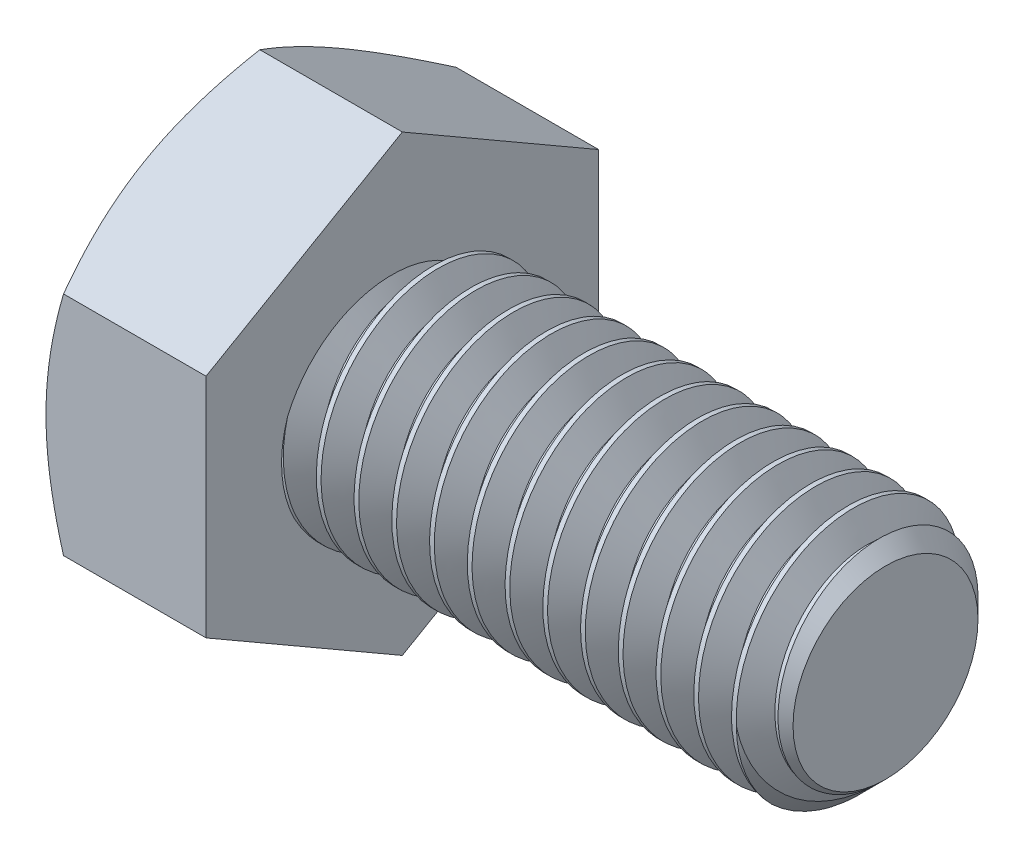
from build123d import *

# Parameters (mm, degrees)
SKETCH2_R           = 4
BOSS_EXTRUDE1_DEPTH = 16
CHAMFER1_SIZE       = 0.9375
CUT_SWEEP1_PITCH    = 1.25
BOSS_EXTRUDE2_DEPTH = 5.3
SKETCH6_OUTSIDE_W   = 105.696
SKETCH6_OUTSIDE_H   = 107.708
SKETCH6_OUTSIDE_R   = 6.5
CUT_EXTRUDE1_DEPTH  = 24.500496599
CUT_EXTRUDE1_DRAFT  = -60
SKETCH7_W           = 0.197562976
SKETCH7_H           = 0.197562976
CUT_EXTRUDE2_DEPTH  = 0.25


with BuildPart() as part:
    # Sketch2 → Boss-Extrude1 (new body)
    with BuildSketch(Plane(origin=(10.65, 0, 0), x_dir=(0, 0, -1), z_dir=(1, 0, 0))):
        Circle(SKETCH2_R)
    extrude(amount=-BOSS_EXTRUDE1_DEPTH)

    # Chamfer1
    chamfer1_edges = [part.edges().sort_by_distance(p)[0] for p in [
        (10.65, 0, 4),
    ]]
    chamfer(chamfer1_edges, length=CHAMFER1_SIZE)

    # Cut-Sweep1: the profile of Sketch5 profile screwed along a right-hand helix of 13.8 turns, 8 arcs to a turn; built about Z, then put on its axis
    cut_sweep1_z = Axis((0, 0, 0), (0, 0, 1))
    cut_sweep1_corners = [(4.0003, 0, 0.000173205), (3.188101184, 0, -0.46875), (3.188101184, 0, -0.625), (4.0003, 0, -1.093923205)]
    with BuildLine(mode=Mode.PRIVATE) as cut_sweep1_profile:
        Line(cut_sweep1_corners[0], cut_sweep1_corners[1])
        Line(cut_sweep1_corners[1], cut_sweep1_corners[2])
        Line(cut_sweep1_corners[2], cut_sweep1_corners[3])
        Line(cut_sweep1_corners[3], cut_sweep1_corners[0])
    cut_sweep1_cap = Face(cut_sweep1_profile.wire())
    cut_sweep1_turn_angles = [0, 22.5, 45, 67.5, 90, 112.5, 135, 157.5, 180, 202.5, 225, 247.5, 270, 292.5, 315, 337.5, 360]
    cut_sweep1_turn_weights = [1, 0.9238795325112867, 1, 0.9238795325112867, 1, 0.9238795325112867, 1, 0.9238795325112867, 1, 0.9238795325112867, 1, 0.9238795325112867, 1, 0.9238795325112867, 1, 0.9238795325112867, 1]
    cut_sweep1_turn_rails = [Edge.make_bspline([Vector(p[0], p[1], 0).rotate(cut_sweep1_z, cut_sweep1_turn_angles[k]) / cut_sweep1_turn_weights[k] + Vector(0, 0, p[2] + CUT_SWEEP1_PITCH * cut_sweep1_turn_angles[k] / 360) for k in range(17)], [0, 0, 0, 1, 1, 2, 2, 3, 3, 4, 4, 5, 5, 6, 6, 7, 7, 8, 8, 8], 2, cut_sweep1_turn_weights) for p in cut_sweep1_corners]
    cut_sweep1_turn_sides = [Face.make_surface_from_curves(cut_sweep1_turn_rails[p[0]], cut_sweep1_turn_rails[p[1]]) for p in [(0, 1), (1, 2), (2, 3), (3, 0)]]
    cut_sweep1_last_angles = [4680, 4702.5, 4725, 4747.5, 4770, 4792.5, 4815, 4837.5, 4860, 4882.5, 4905, 4927.5, 4950, 4959, 4968]
    cut_sweep1_last_weights = [1, 0.9238795325112867, 1, 0.9238795325112867, 1, 0.9238795325112867, 1, 0.9238795325112867, 1, 0.9238795325112867, 1, 0.9238795325112867, 1, 0.9876883405951452, 1]
    cut_sweep1_last_rails = [Edge.make_bspline([Vector(p[0], p[1], 0).rotate(cut_sweep1_z, cut_sweep1_last_angles[k]) / cut_sweep1_last_weights[k] + Vector(0, 0, p[2] + CUT_SWEEP1_PITCH * cut_sweep1_last_angles[k] / 360) for k in range(15)], [0, 0, 0, 1, 1, 2, 2, 3, 3, 4, 4, 5, 5, 6, 6, 7, 7, 7], 2, cut_sweep1_last_weights) for p in cut_sweep1_corners]
    cut_sweep1_last_sides = [Face.make_surface_from_curves(cut_sweep1_last_rails[p[0]], cut_sweep1_last_rails[p[1]]) for p in [(0, 1), (1, 2), (2, 3), (3, 0)]]
    cut_sweep1 = Plane(origin=(10.65, 0, 0), x_dir=(0, 1, 0), z_dir=(-1, 0, 0)) * Solid(Shell([*[p.moved(Location((0, 0, CUT_SWEEP1_PITCH * i))) for i in range(13) for p in cut_sweep1_turn_sides], *cut_sweep1_last_sides, cut_sweep1_cap, cut_sweep1_cap.rotate(cut_sweep1_z, 4968).moved(Location((0, 0, CUT_SWEEP1_PITCH * 4968 / 360)))]))
    add(cut_sweep1, mode=Mode.SUBTRACT)

    # Sketch3 → Boss-Extrude2 (add)
    with BuildSketch(Plane.ZY.offset(5.35)):
        Polygon((-6.5, -3.75277675), (0, -7.505553499), (6.5, -3.75277675), (6.5, 3.75277675), (0, 7.505553499), (-6.5, 3.75277675), align=None)
    extrude(amount=BOSS_EXTRUDE2_DEPTH)


with BuildPart() as cut_extrude1_tool:
    # Sketch6 outside → Cut-Extrude1 (with draft: the straight prism first)
    with BuildSketch(Plane.ZY.offset(10.65)):
        Rectangle(SKETCH6_OUTSIDE_W, SKETCH6_OUTSIDE_H)
        Circle(SKETCH6_OUTSIDE_R, mode=Mode.SUBTRACT)
    extrude(amount=-CUT_EXTRUDE1_DEPTH)
    # Cut-Extrude1: the draft: its side faces are tilted about the plane it starts from
    cut_extrude1_sides = [cut_extrude1_tool.faces().sort_by_distance(p)[0] for p in [
        (1.600248299, -53.854, 0),
        (1.600248299, 0, 52.848),
        (1.600248299, 53.854, 0),
        (1.600248299, 0, -52.848),
        (1.600248299, 0, -6.5),
    ]]
    draft(cut_extrude1_sides, Plane.ZY.offset(10.65), CUT_EXTRUDE1_DRAFT)


with BuildPart() as part_1:
    add(part.part)

    # Cut-Extrude1: cut by cut_extrude1_tool
    add(cut_extrude1_tool.part, mode=Mode.SUBTRACT)

    # Sketch7 → Cut-Extrude2 (cut)
    # profile 1 of 3: a face of its own
    with BuildSketch(Plane.ZY.offset(10.65)):
        with BuildLine():
            add(Edge.make_bspline(
                [(-1.090300672, 4.095199106), (-1.10904591, 4.102532349), (-1.144986747, 4.116592608), (-1.19346167, 4.144731144), (-1.234487944, 4.177100824), (-1.26756182, 4.214482221), (-1.292770127, 4.256102561), (-1.310921105, 4.301431184), (-1.321552451, 4.350720623), (-1.322951659, 4.384803), (-1.323671938, 4.402347795)],
                knots=[0, 0, 0, 0, 1.16287356, 2.229614231, 3.228817875, 4.173350329, 5.100165549, 6.029633206, 6.985702163, 8, 8, 8, 8], degree=3))
            add(Edge.make_bspline(
                [(-1.323671938, 4.402347795), (-1.323332936, 4.415847741), (-1.322667465, 4.442348557), (-1.316917644, 4.481234018), (-1.307708477, 4.518496018), (-1.294638515, 4.554029389), (-1.278263995, 4.588126603), (-1.257602111, 4.620162984), (-1.233852559, 4.651043945), (-1.206031088, 4.679521184), (-1.175372308, 4.705603578), (-1.142164064, 4.728814347), (-1.106152247, 4.747795114), (-1.067937276, 4.763664634), (-1.027330198, 4.776088791), (-0.984187971, 4.784550333), (-0.938662683, 4.789932502), (-0.907467674, 4.790632812), (-0.891502928, 4.790991211)],
                knots=[0, 0, 0, 0, 0.994101948, 1.951453197, 2.889123786, 3.817215529, 4.736003873, 5.669743943, 6.620499649, 7.601567446, 8.596478358, 9.582687259, 10.579761808, 11.589151689, 12.62747492, 13.702346593, 14.8241243, 16, 16, 16, 16], degree=3))
            add(Edge.make_bspline(
                [(-0.891502928, 4.790991211), (-0.875436453, 4.790629173), (-0.844140773, 4.789923964), (-0.798373618, 4.78461411), (-0.754959136, 4.775714465), (-0.713922888, 4.763088109), (-0.675200178, 4.746944553), (-0.639045453, 4.727102003), (-0.605086523, 4.703887727), (-0.574191365, 4.677024885), (-0.546080454, 4.647860574), (-0.521725005, 4.616615726), (-0.500836111, 4.584019418), (-0.483574579, 4.54987362), (-0.470804432, 4.513789502), (-0.461070714, 4.476446906), (-0.455424706, 4.43740213), (-0.454742415, 4.410906185), (-0.454394844, 4.39740872)],
                knots=[0, 0, 0, 0, 1.171211919, 2.281388661, 3.353996503, 4.398126828, 5.406889753, 6.407389155, 7.400009931, 8.40008733, 9.387021643, 10.349004252, 11.283445052, 12.206096336, 13.131640667, 14.068727932, 15.016178647, 16, 16, 16, 16], degree=3))
            add(Edge.make_bspline(
                [(-0.454394844, 4.39740872), (-0.454959462, 4.380468619), (-0.45606657, 4.347252266), (-0.467348502, 4.299370618), (-0.484932357, 4.254670699), (-0.510346333, 4.214004413), (-0.542532189, 4.176951768), (-0.58247227, 4.144741497), (-0.629560012, 4.116646938), (-0.6645934, 4.102540833), (-0.682827035, 4.095199106)],
                knots=[0, 0, 0, 0, 0.998680737, 1.958225066, 2.887911823, 3.823713378, 4.77537694, 5.772726054, 6.840782926, 8, 8, 8, 8], degree=3))
            add(Edge.make_bspline(
                [(-0.682827035, 4.095199106), (-0.671322795, 4.091293961), (-0.648779475, 4.083641573), (-0.616909948, 4.06876297), (-0.586905745, 4.052720306), (-0.558597671, 4.035354111), (-0.533030646, 4.015372905), (-0.509351678, 3.993958093), (-0.487660326, 3.970807897), (-0.468252869, 3.945725424), (-0.450925963, 3.919237111), (-0.436092756, 3.891278379), (-0.423495199, 3.862247184), (-0.412728892, 3.832008902), (-0.404864956, 3.800350539), (-0.399362666, 3.767417581), (-0.395871617, 3.733383598), (-0.395377091, 3.71026846), (-0.395125952, 3.698529693)],
                knots=[0, 0, 0, 0, 1.104208047, 2.163768705, 3.193778962, 4.198696312, 5.179575955, 6.14024585, 7.100368562, 8.060719304, 9.021161243, 9.975749006, 10.935506756, 11.897452199, 12.89163552, 13.897859372, 14.932451246, 16, 16, 16, 16], degree=3))
            add(Edge.make_bspline(
                [(-0.395125952, 3.698529693), (-0.395518566, 3.682350494), (-0.396292046, 3.650476238), (-0.403088084, 3.603688571), (-0.413370791, 3.558742632), (-0.428364165, 3.515828291), (-0.447514428, 3.474915209), (-0.471203535, 3.436062798), (-0.499198733, 3.399311024), (-0.530674211, 3.364545652), (-0.565863777, 3.33311926), (-0.603932369, 3.305425676), (-0.645022826, 3.282228768), (-0.688636579, 3.263021811), (-0.734982466, 3.248136491), (-0.784000913, 3.237713611), (-0.835675608, 3.231507244), (-0.871009164, 3.230670526), (-0.889033391, 3.230243702)],
                knots=[0, 0, 0, 0, 1.017598406, 2.004746413, 2.969099523, 3.915171376, 4.859468899, 5.806714415, 6.772805022, 7.762836953, 8.753334612, 9.736396794, 10.719437652, 11.716790048, 12.730404696, 13.776887535, 14.865953843, 16, 16, 16, 16], degree=3))
            add(Edge.make_bspline(
                [(-0.889033391, 3.230243702), (-0.907055815, 3.230679725), (-0.942385837, 3.231534475), (-0.994107744, 3.237613962), (-1.043056058, 3.248509339), (-1.089341685, 3.26340979), (-1.133215708, 3.282096716), (-1.174030202, 3.305816309), (-1.212347458, 3.333474808), (-1.247561492, 3.365095581), (-1.279298421, 3.399857245), (-1.306924581, 3.437151785), (-1.330473058, 3.476405251), (-1.349852944, 3.517838923), (-1.364624836, 3.561453179), (-1.374991925, 3.607084275), (-1.381800265, 3.654697342), (-1.382555285, 3.687186894), (-1.38294083, 3.70377746)],
                knots=[0, 0, 0, 0, 1.127066097, 2.209429196, 3.250843736, 4.258219581, 5.246860502, 6.227045772, 7.204057202, 8.19754525, 9.181483529, 10.142920909, 11.095356922, 12.039670968, 12.998174893, 13.969127444, 14.962948905, 16, 16, 16, 16], degree=3))
            add(Edge.make_bspline(
                [(-1.38294083, 3.70377746), (-1.382672847, 3.716130371), (-1.382147017, 3.74036892), (-1.378934902, 3.775920275), (-1.372533218, 3.809804454), (-1.364287442, 3.842221135), (-1.353817885, 3.873251416), (-1.340901695, 3.902651616), (-1.325231028, 3.930350678), (-1.307428123, 3.956528839), (-1.287268328, 3.981002318), (-1.265078386, 4.003556797), (-1.240777693, 4.023935731), (-1.214912328, 4.04273433), (-1.18639811, 4.058622835), (-1.156295471, 4.073203498), (-1.124086869, 4.0856381), (-1.101675528, 4.091980186), (-1.090300672, 4.095199106)],
                knots=[0, 0, 0, 0, 1.117345089, 2.192424383, 3.22371675, 4.232639188, 5.215561493, 6.182180952, 7.132172269, 8.089790513, 9.041830748, 9.996006267, 10.94686322, 11.907506267, 12.882866327, 13.894317773, 14.931262935, 16, 16, 16, 16], degree=3))
        make_face()
        with BuildLine():
            add(Edge.make_bspline(
                [(-1.126108962, 4.401421718), (-1.125522597, 4.38569432), (-1.124389481, 4.35530201), (-1.112066715, 4.31213196), (-1.092797487, 4.273353149), (-1.070207698, 4.245231653), (-1.048549764, 4.226071024), (-1.030473235, 4.213278152), (-1.010719085, 4.202417262), (-0.989144204, 4.193975494), (-0.966271136, 4.186496613), (-0.941311021, 4.182316462), (-0.914850534, 4.178918248), (-0.896557781, 4.178672138), (-0.887181238, 4.178545986)],
                knots=[0, 0, 0, 0, 1.528727296, 2.954179336, 4.335216052, 5.725683216, 6.435919001, 7.148062981, 7.879427438, 8.626027458, 9.402978632, 10.2190538, 11.08711833, 12, 12, 12, 12], degree=3))
            add(Edge.make_bspline(
                [(-0.887181238, 4.178545986), (-0.878011673, 4.178676799), (-0.860131525, 4.178931878), (-0.83426699, 4.182260813), (-0.809825095, 4.186706918), (-0.787167018, 4.193444308), (-0.766031175, 4.202204879), (-0.74676133, 4.213004501), (-0.728780836, 4.225416366), (-0.707759131, 4.244723381), (-0.685200516, 4.271859952), (-0.665866712, 4.308906458), (-0.653818708, 4.349437535), (-0.652589006, 4.377669794), (-0.65195782, 4.392160954)],
                knots=[0, 0, 0, 0, 0.922112375, 1.798068639, 2.620552757, 3.419964248, 4.17189205, 4.918165909, 5.639229138, 6.36503528, 7.785020832, 9.165298717, 10.544993853, 12, 12, 12, 12], degree=3))
            add(Edge.make_bspline(
                [(-0.65195782, 4.392160954), (-0.65271831, 4.407158684), (-0.654206393, 4.436505357), (-0.666224968, 4.47863383), (-0.68645929, 4.516789644), (-0.709574199, 4.544654295), (-0.730967776, 4.564840594), (-0.749271072, 4.577690525), (-0.768947184, 4.588626954), (-0.790070998, 4.59755802), (-0.812673062, 4.604761018), (-0.8368146, 4.609486531), (-0.862394171, 4.6128007), (-0.879966809, 4.613053896), (-0.889033391, 4.613184533)],
                knots=[0, 0, 0, 0, 1.480633456, 2.897216237, 4.289382554, 5.720567045, 6.454675042, 7.191244726, 7.924224627, 8.676083236, 9.454506446, 10.26432127, 11.104478565, 12, 12, 12, 12], degree=3))
            add(Edge.make_bspline(
                [(-0.889033391, 4.613184533), (-0.898100982, 4.613058121), (-0.915777808, 4.612811688), (-0.941524176, 4.609398068), (-0.965894504, 4.60511063), (-0.988663959, 4.598230085), (-1.009737898, 4.589238813), (-1.029336437, 4.578296242), (-1.047605053, 4.565774542), (-1.069148935, 4.546488383), (-1.091712602, 4.519351198), (-1.111590558, 4.482896368), (-1.123875778, 4.443148301), (-1.125355347, 4.415502855), (-1.126108962, 4.401421718)],
                knots=[0, 0, 0, 0, 0.914830409, 1.783417199, 2.618873138, 3.411020283, 4.179090249, 4.927874451, 5.674348476, 6.410336976, 7.841713217, 9.213201474, 10.580551314, 12, 12, 12, 12], degree=3))
        make_face(mode=Mode.SUBTRACT)
        with BuildLine():
            add(Edge.make_bspline(
                [(-1.185377855, 3.707481766), (-1.185036224, 3.694805043), (-1.184352062, 3.669418206), (-1.17835049, 3.631713372), (-1.168167066, 3.594710671), (-1.155115235, 3.558375151), (-1.136704816, 3.524173378), (-1.11229053, 3.493645779), (-1.081655173, 3.467980015), (-1.046667921, 3.446296603), (-1.008487833, 3.429229893), (-0.968703065, 3.417316749), (-0.928340442, 3.409445139), (-0.901108325, 3.408515353), (-0.88748993, 3.408050381)],
                knots=[0, 0, 0, 0, 0.957879255, 1.91828174, 2.876792425, 3.856375228, 4.831004356, 5.799187063, 6.79220414, 7.836856316, 8.902268238, 9.943090861, 10.971368942, 12, 12, 12, 12], degree=3))
            add(Edge.make_bspline(
                [(-0.88748993, 3.408050381), (-0.876260095, 3.408240606), (-0.854443727, 3.408610159), (-0.822642292, 3.412833099), (-0.792678151, 3.419240679), (-0.764414025, 3.428026522), (-0.738265928, 3.440046137), (-0.713808052, 3.454094456), (-0.691290567, 3.471072925), (-0.670719849, 3.490449644), (-0.65230541, 3.511883927), (-0.636531114, 3.535006834), (-0.62277101, 3.559168091), (-0.611536514, 3.584889135), (-0.603412162, 3.612223005), (-0.597143078, 3.640676539), (-0.593361124, 3.670543219), (-0.59291624, 3.690904396), (-0.592688927, 3.701307923)],
                knots=[0, 0, 0, 0, 1.149387474, 2.232932207, 3.278773642, 4.285224938, 5.256757121, 6.220082341, 7.168479488, 8.137608443, 9.109140627, 10.056190326, 10.999892409, 11.953252726, 12.923240661, 13.915357002, 14.934853301, 16, 16, 16, 16], degree=3))
            add(Edge.make_bspline(
                [(-0.592688927, 3.701307923), (-0.59292348, 3.711915659), (-0.593382696, 3.732683917), (-0.597068538, 3.763206109), (-0.603689152, 3.79216024), (-0.612203291, 3.819983723), (-0.623742382, 3.84619251), (-0.637593446, 3.871162402), (-0.654555372, 3.894235249), (-0.673155477, 3.916194378), (-0.694204567, 3.936072466), (-0.717449351, 3.953214091), (-0.742153148, 3.96835305), (-0.769063272, 3.97996591), (-0.797586855, 3.989268075), (-0.827859408, 3.996027169), (-0.860004362, 4.000158824), (-0.882023513, 4.000542077), (-0.893355081, 4.000739308)],
                knots=[0, 0, 0, 0, 1.065858887, 2.086781919, 3.082735321, 4.047496077, 5.006086125, 5.955204095, 6.910833714, 7.878747924, 8.844339535, 9.812198509, 10.776903849, 11.749116737, 12.749729282, 13.788304076, 14.861809717, 16, 16, 16, 16], degree=3))
            add(Edge.make_bspline(
                [(-0.893355081, 4.000739308), (-0.904378933, 4.000540114), (-0.925989116, 4.000149633), (-0.957382737, 3.995994574), (-0.987102852, 3.989613782), (-1.014887981, 3.980274644), (-1.041085524, 3.968604441), (-1.065216337, 3.953929996), (-1.087710912, 3.936897153), (-1.10788212, 3.917099713), (-1.126081777, 3.89559431), (-1.141817329, 3.872540585), (-1.155718095, 3.848473314), (-1.166267093, 3.822602762), (-1.175195875, 3.795765278), (-1.180777776, 3.767439974), (-1.18474581, 3.737948677), (-1.185164094, 3.717785837), (-1.185377855, 3.707481766)],
                knots=[0, 0, 0, 0, 1.135239447, 2.225422834, 3.256957183, 4.262780498, 5.240265059, 6.205773948, 7.16638056, 8.141101257, 9.111719309, 10.064571387, 11.014055337, 11.969087385, 12.938082716, 13.92369833, 14.938921288, 16, 16, 16, 16], degree=3))
        make_face(mode=Mode.SUBTRACT)
    # profile 2 of 3: a face of its own
    with BuildSketch(Plane.ZY.offset(10.65)):
        with Locations((0, 3.348781488)):
            Rectangle(SKETCH7_W, SKETCH7_H)
    # profile 3 of 3: a face of its own
    with BuildSketch(Plane.ZY.offset(10.65)):
        with BuildLine():
            add(Edge.make_bspline(
                [(0.687766109, 4.095199106), (0.669020872, 4.102532349), (0.633080035, 4.116592608), (0.584605112, 4.144731144), (0.543578838, 4.177100824), (0.510504961, 4.214482221), (0.485296655, 4.256102561), (0.467145677, 4.301431184), (0.456514331, 4.350720623), (0.455115123, 4.384803), (0.454394844, 4.402347795)],
                knots=[0, 0, 0, 0, 1.16287356, 2.229614231, 3.228817875, 4.173350329, 5.100165549, 6.029633206, 6.985702163, 8, 8, 8, 8], degree=3))
            add(Edge.make_bspline(
                [(0.454394844, 4.402347795), (0.454733846, 4.415847741), (0.455399317, 4.442348557), (0.461149138, 4.481234018), (0.470358305, 4.518496018), (0.483428267, 4.554029389), (0.499802787, 4.588126603), (0.520464671, 4.620162984), (0.544214223, 4.651043945), (0.572035694, 4.679521184), (0.602694474, 4.705603578), (0.635902718, 4.728814347), (0.671914535, 4.747795114), (0.710129506, 4.763664634), (0.750736584, 4.776088791), (0.793878811, 4.784550333), (0.839404099, 4.789932502), (0.870599108, 4.790632812), (0.886563854, 4.790991211)],
                knots=[0, 0, 0, 0, 0.994101948, 1.951453197, 2.889123786, 3.817215529, 4.736003873, 5.669743943, 6.620499649, 7.601567446, 8.596478358, 9.582687259, 10.579761808, 11.589151689, 12.62747492, 13.702346593, 14.8241243, 16, 16, 16, 16], degree=3))
            add(Edge.make_bspline(
                [(0.886563854, 4.790991211), (0.902630329, 4.790629173), (0.933926009, 4.789923964), (0.979693164, 4.78461411), (1.023107646, 4.775714465), (1.064143894, 4.763088109), (1.102866604, 4.746944553), (1.139021329, 4.727102003), (1.172980259, 4.703887727), (1.203875417, 4.677024885), (1.231986328, 4.647860574), (1.256341777, 4.616615726), (1.277230671, 4.584019418), (1.294492203, 4.54987362), (1.30726235, 4.513789502), (1.316996068, 4.476446906), (1.322642076, 4.43740213), (1.323324367, 4.410906185), (1.323671938, 4.39740872)],
                knots=[0, 0, 0, 0, 1.171211919, 2.281388661, 3.353996503, 4.398126828, 5.406889753, 6.407389155, 7.400009931, 8.40008733, 9.387021643, 10.349004252, 11.283445052, 12.206096336, 13.131640667, 14.068727932, 15.016178647, 16, 16, 16, 16], degree=3))
            add(Edge.make_bspline(
                [(1.323671938, 4.39740872), (1.32310732, 4.380468619), (1.322000212, 4.347252266), (1.31071828, 4.299370618), (1.293134425, 4.254670699), (1.267720449, 4.214004413), (1.235534593, 4.176951768), (1.195594512, 4.144741497), (1.148506769, 4.116646938), (1.113473382, 4.102540833), (1.095239747, 4.095199106)],
                knots=[0, 0, 0, 0, 0.998680737, 1.958225066, 2.887911823, 3.823713378, 4.77537694, 5.772726054, 6.840782926, 8, 8, 8, 8], degree=3))
            add(Edge.make_bspline(
                [(1.095239747, 4.095199106), (1.106743987, 4.091293961), (1.129287306, 4.083641573), (1.161156834, 4.06876297), (1.191161037, 4.052720306), (1.219469111, 4.035354111), (1.245036136, 4.015372905), (1.268715103, 3.993958093), (1.290406456, 3.970807897), (1.309813913, 3.945725424), (1.327140819, 3.919237111), (1.341974025, 3.891278379), (1.354571583, 3.862247184), (1.36533789, 3.832008902), (1.373201826, 3.800350539), (1.378704116, 3.767417581), (1.382195165, 3.733383598), (1.382689691, 3.71026846), (1.38294083, 3.698529693)],
                knots=[0, 0, 0, 0, 1.104208047, 2.163768705, 3.193778962, 4.198696312, 5.179575955, 6.14024585, 7.100368562, 8.060719304, 9.021161243, 9.975749006, 10.935506756, 11.897452199, 12.89163552, 13.897859372, 14.932451246, 16, 16, 16, 16], degree=3))
            add(Edge.make_bspline(
                [(1.38294083, 3.698529693), (1.382548216, 3.682350494), (1.381774736, 3.650476238), (1.374978698, 3.603688571), (1.364695991, 3.558742632), (1.349702617, 3.515828291), (1.330552354, 3.474915209), (1.306863247, 3.436062798), (1.278868049, 3.399311024), (1.247392571, 3.364545652), (1.212203005, 3.33311926), (1.174134413, 3.305425676), (1.133043956, 3.282228768), (1.089430203, 3.263021811), (1.043084316, 3.248136491), (0.994065869, 3.237713611), (0.942391174, 3.231507244), (0.907057618, 3.230670526), (0.889033391, 3.230243702)],
                knots=[0, 0, 0, 0, 1.017598406, 2.004746413, 2.969099523, 3.915171376, 4.859468899, 5.806714415, 6.772805022, 7.762836953, 8.753334612, 9.736396794, 10.719437652, 11.716790048, 12.730404696, 13.776887535, 14.865953843, 16, 16, 16, 16], degree=3))
            add(Edge.make_bspline(
                [(0.889033391, 3.230243702), (0.871010967, 3.230679725), (0.835680945, 3.231534475), (0.783959037, 3.237613962), (0.735010724, 3.248509339), (0.688725097, 3.26340979), (0.644851074, 3.282096716), (0.60403658, 3.305816309), (0.565719324, 3.333474808), (0.53050529, 3.365095581), (0.49876836, 3.399857245), (0.471142201, 3.437151785), (0.447593724, 3.476405251), (0.428213838, 3.517838923), (0.413441946, 3.561453179), (0.403074856, 3.607084275), (0.396266517, 3.654697342), (0.395511497, 3.687186894), (0.395125952, 3.70377746)],
                knots=[0, 0, 0, 0, 1.127066097, 2.209429196, 3.250843736, 4.258219581, 5.246860502, 6.227045772, 7.204057202, 8.19754525, 9.181483529, 10.142920909, 11.095356922, 12.039670968, 12.998174893, 13.969127444, 14.962948905, 16, 16, 16, 16], degree=3))
            add(Edge.make_bspline(
                [(0.395125952, 3.70377746), (0.395393935, 3.716130371), (0.395919765, 3.74036892), (0.39913188, 3.775920275), (0.405533564, 3.809804454), (0.41377934, 3.842221135), (0.424248897, 3.873251416), (0.437165087, 3.902651616), (0.452835754, 3.930350678), (0.470638659, 3.956528839), (0.490798454, 3.981002318), (0.512988396, 4.003556797), (0.537289089, 4.023935731), (0.563154454, 4.04273433), (0.591668672, 4.058622835), (0.621771311, 4.073203498), (0.653979913, 4.0856381), (0.676391254, 4.091980186), (0.687766109, 4.095199106)],
                knots=[0, 0, 0, 0, 1.117345089, 2.192424383, 3.22371675, 4.232639188, 5.215561493, 6.182180952, 7.132172269, 8.089790513, 9.041830748, 9.996006267, 10.94686322, 11.907506267, 12.882866327, 13.894317773, 14.931262935, 16, 16, 16, 16], degree=3))
        make_face()
        with BuildLine():
            add(Edge.make_bspline(
                [(0.65195782, 4.401421718), (0.652544185, 4.38569432), (0.653677301, 4.35530201), (0.666000066, 4.31213196), (0.685269295, 4.273353149), (0.707859084, 4.245231653), (0.729517018, 4.226071024), (0.747593547, 4.213278152), (0.767347697, 4.202417262), (0.788922578, 4.193975494), (0.811795646, 4.186496613), (0.83675576, 4.182316462), (0.863216248, 4.178918248), (0.881509001, 4.178672138), (0.890885544, 4.178545986)],
                knots=[0, 0, 0, 0, 1.528727296, 2.954179336, 4.335216052, 5.725683216, 6.435919001, 7.148062981, 7.879427438, 8.626027458, 9.402978632, 10.2190538, 11.08711833, 12, 12, 12, 12], degree=3))
            add(Edge.make_bspline(
                [(0.890885544, 4.178545986), (0.900055108, 4.178676799), (0.917935257, 4.178931878), (0.943799792, 4.182260813), (0.968241687, 4.186706918), (0.990899763, 4.193444308), (1.012035607, 4.202204879), (1.031305452, 4.213004501), (1.049285946, 4.225416366), (1.070307651, 4.244723381), (1.092866266, 4.271859952), (1.11220007, 4.308906458), (1.124248074, 4.349437535), (1.125477776, 4.377669794), (1.126108962, 4.392160954)],
                knots=[0, 0, 0, 0, 0.922112375, 1.798068639, 2.620552757, 3.419964248, 4.17189205, 4.918165909, 5.639229138, 6.36503528, 7.785020832, 9.165298717, 10.544993853, 12, 12, 12, 12], degree=3))
            add(Edge.make_bspline(
                [(1.126108962, 4.392160954), (1.125348471, 4.407158684), (1.123860389, 4.436505357), (1.111841814, 4.47863383), (1.091607492, 4.516789644), (1.068492583, 4.544654295), (1.047099006, 4.564840594), (1.02879571, 4.577690525), (1.009119598, 4.588626954), (0.987995784, 4.59755802), (0.96539372, 4.604761018), (0.941252181, 4.609486531), (0.915672611, 4.6128007), (0.898099973, 4.613053896), (0.889033391, 4.613184533)],
                knots=[0, 0, 0, 0, 1.480633456, 2.897216237, 4.289382554, 5.720567045, 6.454675042, 7.191244726, 7.924224627, 8.676083236, 9.454506446, 10.26432127, 11.104478565, 12, 12, 12, 12], degree=3))
            add(Edge.make_bspline(
                [(0.889033391, 4.613184533), (0.8799658, 4.613058121), (0.862288974, 4.612811688), (0.836542606, 4.609398068), (0.812172278, 4.60511063), (0.789402822, 4.598230085), (0.768328884, 4.589238813), (0.748730345, 4.578296242), (0.730461729, 4.565774542), (0.708917847, 4.546488383), (0.68635418, 4.519351198), (0.666476224, 4.482896368), (0.654191004, 4.443148301), (0.652711435, 4.415502855), (0.65195782, 4.401421718)],
                knots=[0, 0, 0, 0, 0.914830409, 1.783417199, 2.618873138, 3.411020283, 4.179090249, 4.927874451, 5.674348476, 6.410336976, 7.841713217, 9.213201474, 10.580551314, 12, 12, 12, 12], degree=3))
        make_face(mode=Mode.SUBTRACT)
        with BuildLine():
            add(Edge.make_bspline(
                [(0.592688927, 3.707481766), (0.593030558, 3.694805043), (0.59371472, 3.669418206), (0.599716292, 3.631713372), (0.609899716, 3.594710671), (0.622951547, 3.558375151), (0.641361966, 3.524173378), (0.665776252, 3.493645779), (0.696411609, 3.467980015), (0.731398861, 3.446296603), (0.769578949, 3.429229893), (0.809363717, 3.417316749), (0.84972634, 3.409445139), (0.876958457, 3.408515353), (0.890576852, 3.408050381)],
                knots=[0, 0, 0, 0, 0.957879255, 1.91828174, 2.876792425, 3.856375228, 4.831004356, 5.799187063, 6.79220414, 7.836856316, 8.902268238, 9.943090861, 10.971368942, 12, 12, 12, 12], degree=3))
            add(Edge.make_bspline(
                [(0.890576852, 3.408050381), (0.901806687, 3.408240606), (0.923623055, 3.408610159), (0.955424489, 3.412833099), (0.98538863, 3.419240679), (1.013652757, 3.428026522), (1.039800853, 3.440046137), (1.06425873, 3.454094456), (1.086776215, 3.471072925), (1.107346933, 3.490449644), (1.125761372, 3.511883927), (1.141535667, 3.535006834), (1.155295772, 3.559168091), (1.166530268, 3.584889135), (1.17465462, 3.612223005), (1.180923704, 3.640676539), (1.184705658, 3.670543219), (1.185150542, 3.690904396), (1.185377855, 3.701307923)],
                knots=[0, 0, 0, 0, 1.149387474, 2.232932207, 3.278773642, 4.285224938, 5.256757121, 6.220082341, 7.168479488, 8.137608443, 9.109140627, 10.056190326, 10.999892409, 11.953252726, 12.923240661, 13.915357002, 14.934853301, 16, 16, 16, 16], degree=3))
            add(Edge.make_bspline(
                [(1.185377855, 3.701307923), (1.185143302, 3.711915659), (1.184684086, 3.732683917), (1.180998244, 3.763206109), (1.174377629, 3.79216024), (1.165863491, 3.819983723), (1.1543244, 3.84619251), (1.140473336, 3.871162402), (1.12351141, 3.894235249), (1.104911305, 3.916194378), (1.083862215, 3.936072466), (1.060617431, 3.953214091), (1.035913634, 3.96835305), (1.00900351, 3.97996591), (0.980479927, 3.989268075), (0.950207373, 3.996027169), (0.91806242, 4.000158824), (0.896043269, 4.000542077), (0.884711701, 4.000739308)],
                knots=[0, 0, 0, 0, 1.065858887, 2.086781919, 3.082735321, 4.047496077, 5.006086125, 5.955204095, 6.910833714, 7.878747924, 8.844339535, 9.812198509, 10.776903849, 11.749116737, 12.749729282, 13.788304076, 14.861809717, 16, 16, 16, 16], degree=3))
            add(Edge.make_bspline(
                [(0.884711701, 4.000739308), (0.873687849, 4.000540114), (0.852077666, 4.000149633), (0.820684044, 3.995994574), (0.79096393, 3.989613782), (0.763178801, 3.980274644), (0.736981258, 3.968604441), (0.712850445, 3.953929996), (0.69035587, 3.936897153), (0.670184662, 3.917099713), (0.651985005, 3.89559431), (0.636249453, 3.872540585), (0.622348687, 3.848473314), (0.611799689, 3.822602762), (0.602870907, 3.795765278), (0.597289006, 3.767439974), (0.593320972, 3.737948677), (0.592902688, 3.717785837), (0.592688927, 3.707481766)],
                knots=[0, 0, 0, 0, 1.135239447, 2.225422834, 3.256957183, 4.262780498, 5.240265059, 6.205773948, 7.16638056, 8.141101257, 9.111719309, 10.064571387, 11.014055337, 11.969087385, 12.938082716, 13.92369833, 14.938921288, 16, 16, 16, 16], degree=3))
        make_face(mode=Mode.SUBTRACT)
    extrude(amount=-CUT_EXTRUDE2_DEPTH, mode=Mode.SUBTRACT)


solid = part_1.part
